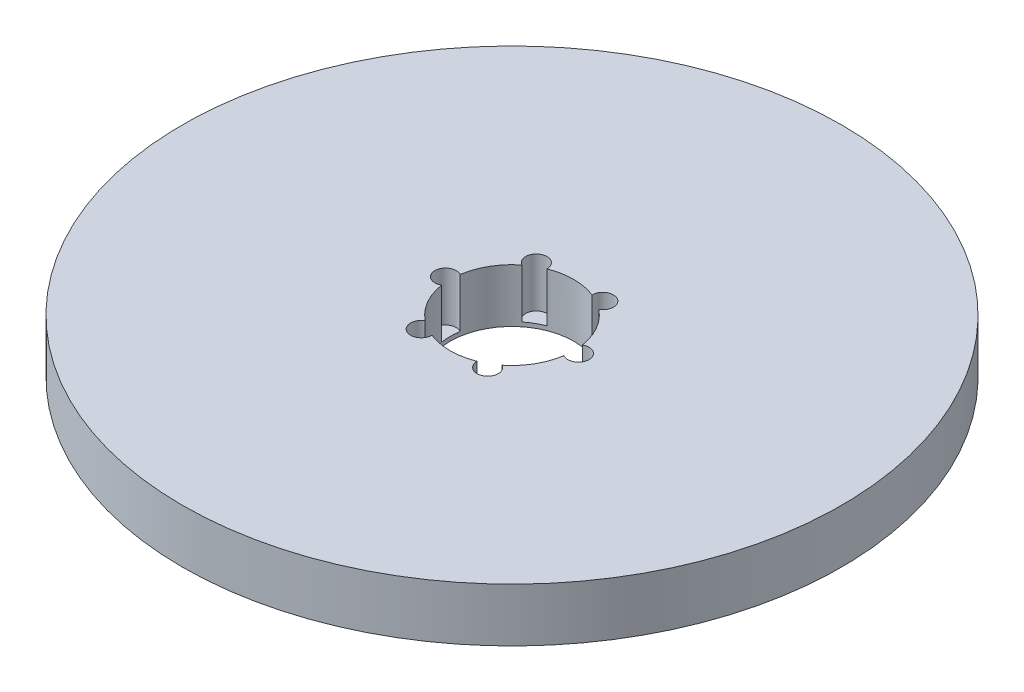
from build123d import *

# Parameters (mm, degrees)
SKETCH1_R           = 80
BOSS_EXTRUDE1_DEPTH = 13
SKETCH2_R           = 15
CUT_EXTRUDE1_DEPTH  = 114.881517377
SKETCH3_R           = 2.586252498
CUT_EXTRUDE2_DEPTH  = 11.979717374
CIRPATTERN1_COUNT   = 6


with BuildPart() as part:
    # Sketch1 → Boss-Extrude1 (new body)
    with BuildSketch(Plane(origin=(0, 0, 0), x_dir=(1, 0, 0), z_dir=(0, 1, 0))):
        Circle(SKETCH1_R)
    extrude(amount=BOSS_EXTRUDE1_DEPTH)

    # Sketch2 → Cut-Extrude1 (cut, through all)
    with BuildSketch(Plane(origin=(0, 0, 0), x_dir=(1, 0, 0), z_dir=(0, 1, 0))):
        Circle(SKETCH2_R)
    extrude(amount=CUT_EXTRUDE1_DEPTH, mode=Mode.SUBTRACT)

    # Sketch3 → Cut-Extrude2 (cut)
    with BuildSketch(Plane(origin=(0, 13, 0), x_dir=(1, 0, 0), z_dir=(0, 1, 0))):
        with Locations((-16.130953977, 0)):
            Circle(SKETCH3_R)
    cut_extrude2 = extrude(amount=-CUT_EXTRUDE2_DEPTH, mode=Mode.SUBTRACT)

    # CirPattern1: Cut-Extrude2 ×6 about axis
    cirpattern1_axis = Axis((0, 0, 0), (0, 1, 0))
    for i in range(1, CIRPATTERN1_COUNT):
        add(cut_extrude2.rotate(cirpattern1_axis, i * 360 / CIRPATTERN1_COUNT), mode=Mode.SUBTRACT)


solid = part.part
